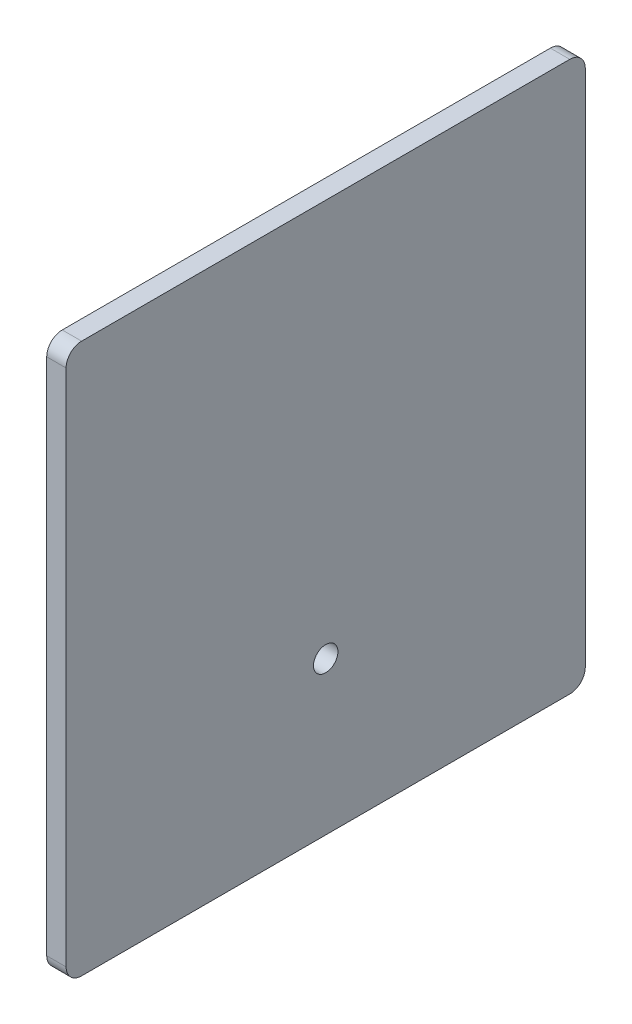
from build123d import *

# Parameters (mm, degrees)
SKETCH1_W           = 84.999999926
SKETCH1_H           = 90
BOSS_EXTRUDE1_DEPTH = 3.175
SKETCH2_R           = 2
CUT_EXTRUDE1_DEPTH  = 62.978469018
FILLET1_R           = 2.54


with BuildPart() as part:
    # Sketch1 → Boss-Extrude1 (new body)
    with BuildSketch(Plane(origin=(0, 0, 0), x_dir=(0, 0, -1), z_dir=(1, 0, 0))):
        Rectangle(SKETCH1_W, SKETCH1_H)
    extrude(amount=BOSS_EXTRUDE1_DEPTH)

    # Sketch2 → Cut-Extrude1 (cut, through all)
    with BuildSketch(Plane(origin=(3.175, 0, 0), x_dir=(0, 0, -1), z_dir=(1, 0, 0))):
        with Locations((3.7e-08, -20)):
            Circle(SKETCH2_R)
    extrude(amount=-CUT_EXTRUDE1_DEPTH, mode=Mode.SUBTRACT)

    # Fillet1
    fillet1_edges = [part.edges().sort_by_distance(p)[0] for p in [
        (1.5875, -45, 42.499999963),
        (1.5875, -45, -42.499999963),
        (1.5875, 45, -42.499999963),
        (1.5875, 45, 42.499999963),
    ]]
    fillet(fillet1_edges, radius=FILLET1_R)


solid = part.part
